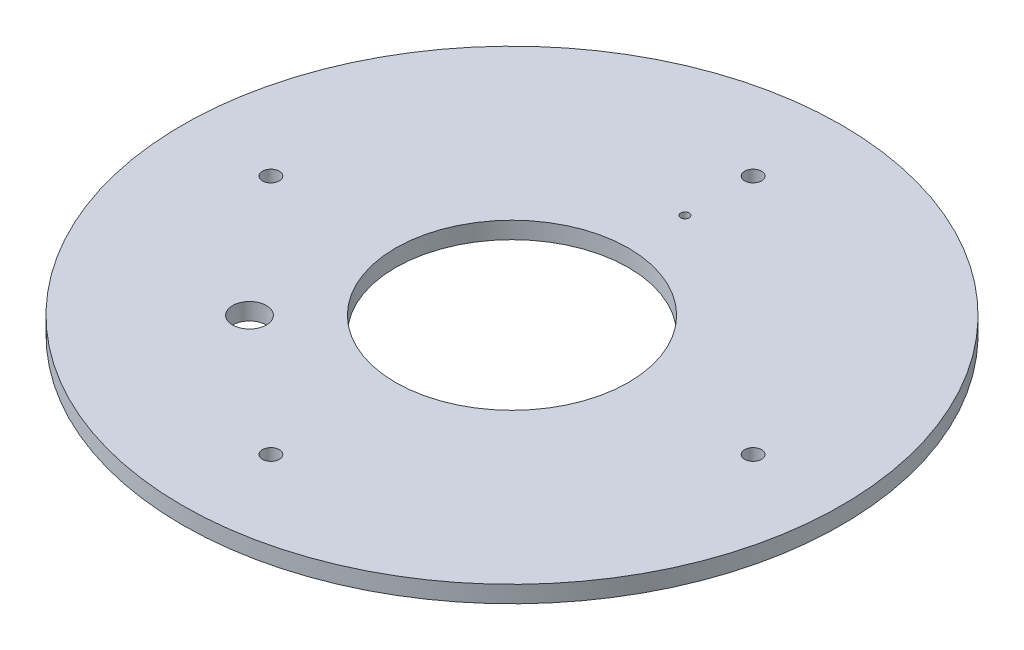
from build123d import *

# Parameters (mm, degrees)
SKETCH1_R                                       = 19.53
SKETCH1_R_2                                     = 6.9
BOSS_EXTRUDE1_DEPTH                             = 1
CSK_FOR_M2_FLAT_HEAD_MACHINE_SCREW1_D           = 1
CSK_FOR_M2_FLAT_HEAD_MACHINE_SCREW1_CSINK_D     = 1.6
CSK_FOR_M2_FLAT_HEAD_MACHINE_SCREW1_CSINK_ANGLE = 100
CUT_EXTRUDE1_DEPTH                              = 28.637688036
CUT_EXTRUDE1_DEPTH_BACK                         = 28.637688036
SKETCH4_R                                       = 0.25
SKETCH4_R_2                                     = 1


with BuildPart() as part:
    # Sketch1 → Boss-Extrude1 (new body)
    with BuildSketch(Plane(origin=(0, 0, 0), x_dir=(1, 0, 0), z_dir=(0, 1, 0))):
        Circle(SKETCH1_R)
        Circle(SKETCH1_R_2, mode=Mode.SUBTRACT)
    extrude(amount=BOSS_EXTRUDE1_DEPTH)

    # CSK for M2 Flat Head Machine Screw1 (through all)
    with Locations(Plane(origin=(0, 0, 0), x_dir=(-1, 0, 0), z_dir=(0, -1, 0))):
        with Locations((0, -14.29), (-14.29, 0), (0, 14.29), (14.29, 0)):
            CounterSinkHole(CSK_FOR_M2_FLAT_HEAD_MACHINE_SCREW1_D / 2, CSK_FOR_M2_FLAT_HEAD_MACHINE_SCREW1_CSINK_D / 2, counter_sink_angle=CSK_FOR_M2_FLAT_HEAD_MACHINE_SCREW1_CSINK_ANGLE)

    # Sketch4 → Cut-Extrude1 (cut, two sides: drawn at the far end of the back side and taken through both)
    with BuildSketch(Plane(origin=(0, 1, 0), x_dir=(1, 0, 0), z_dir=(0, 1, 0)).offset(-CUT_EXTRUDE1_DEPTH_BACK)):
        with Locations((0, 10.25)):
            Circle(SKETCH4_R)
        with Locations((-7.778174593, -7.778174593)):
            Circle(SKETCH4_R_2)
    extrude(amount=CUT_EXTRUDE1_DEPTH + CUT_EXTRUDE1_DEPTH_BACK, mode=Mode.SUBTRACT)


solid = part.part
